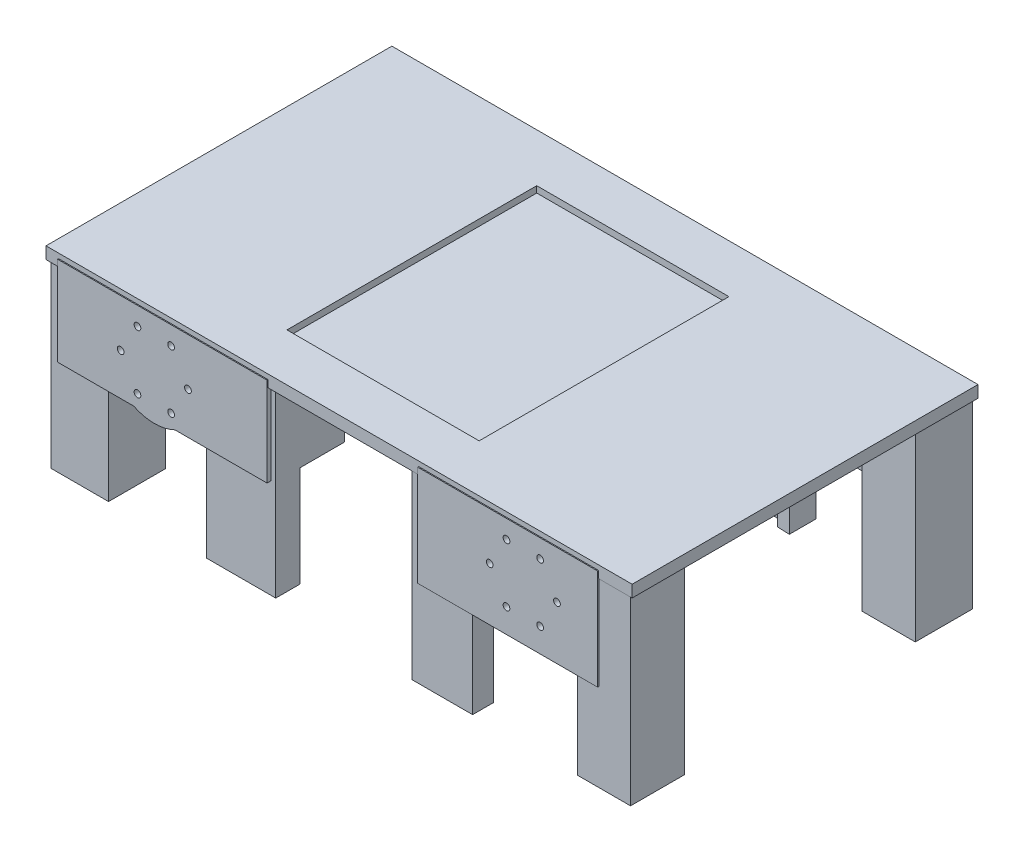
from build123d import *

# Parameters (mm, degrees)
MOTORHOLDERS_DEPTH            = 80
MOTORHOLDERS_DEPTH_BACK       = 80
MOTORHOLDERSSKETCH_R          = 21.41
MOTORHOLDERS_2_DEPTH          = 80
MOTORHOLDERS_2_DEPTH_BACK     = 80
BOSS_EXTRUDE2_DEPTH           = 70
BOSS_EXTRUDE2_DEPTH_BACK      = 70
SKETCH3_W                     = 166.402948119
SKETCH3_H                     = 2.817422897
SKETCH4_W                     = 262.774983374
SKETCH4_H                     = 153.112553215
CUT_EXTRUDE1_DEPTH            = 23
POWERBANKHOLDERS_DEPTH        = 30
POWERBANKHOLDERS_DEPTH_BACK   = 55
SKETCH6_W                     = 26.20968079
SKETCH6_H                     = 26.243040839
SKETCH6_W_2                   = 11.777309193
SKETCH6_H_2                   = 11.261449091
POWERBANKHOLDERS_2_DEPTH      = 30
POWERBANKHOLDERS_2_DEPTH_BACK = 55
SKETCH6_W_3                   = 26.524237007
SKETCH6_H_3                   = 26.17260787
SKETCH6_W_4                   = 10.842850571
SKETCH6_H_4                   = 10.347679347
POWERBANKHOLDERS_3_DEPTH      = 30
POWERBANKHOLDERS_3_DEPTH_BACK = 55
SKETCH6_W_5                   = 25.974547647
SKETCH6_H_5                   = 37.111507406
SKETCH6_W_6                   = 12.844328805
SKETCH6_H_6                   = 18.336479725
POWERBANKHOLDERS_4_DEPTH      = 30
POWERBANKHOLDERS_4_DEPTH_BACK = 55
SKETCH6_W_7                   = 27.98753178
SKETCH6_H_7                   = 35.272094794
SKETCH6_W_8                   = 11.134493861
SKETCH6_H_8                   = 18.035399163
POWERBANKHOLDERS_5_DEPTH      = 30
POWERBANKHOLDERS_5_DEPTH_BACK = 55
SKETCH6_W_9                   = 26.759459577
SKETCH6_H_9                   = 34.283972021
SKETCH6_W_10                  = 12.407504742
SKETCH6_H_10                  = 16.443461188
POWERBANKHOLDERS_6_DEPTH      = 30
POWERBANKHOLDERS_6_DEPTH_BACK = 55
SKETCH6_W_11                  = 31.818060433
SKETCH6_H_11                  = 31.633592667
SKETCH6_W_12                  = 16.537391535
SKETCH6_H_12                  = 14.436538778
POWERBANKHOLDERS_7_DEPTH      = 30
POWERBANKHOLDERS_7_DEPTH_BACK = 55
SKETCH6_W_13                  = 24.409884126
SKETCH6_H_13                  = 24.933985152
SKETCH6_W_14                  = 10.177859407
SKETCH6_H_14                  = 9.83070569
POWERBANKHOLDERS_8_DEPTH      = 30
POWERBANKHOLDERS_8_DEPTH_BACK = 55
SKETCH6_W_15                  = 24.61731082
SKETCH6_H_15                  = 26.330219561
SKETCH6_W_16                  = 9.898416255
SKETCH6_H_16                  = 10.635603546
POWERBANKEXTRUDE_DEPTH        = 64
BOSS_EXTRUDE3_DEPTH           = 2.5
BOSS_EXTRUDE3_DEPTH_BACK      = 3
SKETCH21_W                    = 270.025204679
SKETCH21_H                    = 159.338651477
SKETCH21_W_2                  = 88.537320887
SKETCH21_H_2                  = 115.069025425
SKETCH23_W                    = 96.536837063
SKETCH23_H                    = 41.055975383
SKETCH23_W_2                  = 82.936115801
SKETCH23_H_2                  = 46.337438803
BOSS_EXTRUDE4_DEPTH           = 6
SKETCH24_W                    = 62.643465408
SKETCH24_H                    = 50.528719877
SKETCH24_W_2                  = 58.820967712
SKETCH24_H_2                  = 44.894163551
BOSS_EXTRUDE5_DEPTH           = 6
SKETCH17_R                    = 1.55
BOLTHOLES1_DEPTH              = 31.5
SKETCH19_R                    = 1.55
BOLTHOLES2_DEPTH              = 31.5
BOLTHOLESSKETCH3_R            = 1.55
BOLTHOLES3_DEPTH              = 31.5
BOLTHOLESSKETCH4_R            = 1.55
BOLTHOLES4_DEPTH              = 15
MOTORHOLDEREXTRUDE_DEPTH      = 77
MOTORHOLDEREXTRUDE_DEPTH_BACK = 77
MOTORHOLDEREXTRUDESKETCH_R    = 18.415


with BuildPart() as part:
    # MotorHoldersSketch → MotorHolders (new, two sides: drawn at the far end of the back side and taken through both)
    with BuildSketch(Plane.XY.offset(-MOTORHOLDERS_DEPTH_BACK)):
        Circle(MOTORHOLDERSSKETCH_R)
    extrude(amount=MOTORHOLDERS_DEPTH + MOTORHOLDERS_DEPTH_BACK)


with BuildPart() as body_2:
    # MotorHoldersSketch → MotorHolders 2 (new, two sides: drawn at the far end of the back side and taken through both)
    with BuildSketch(Plane.XY.offset(-MOTORHOLDERS_2_DEPTH_BACK)):
        with Locations((170, 0)):
            Circle(MOTORHOLDERSSKETCH_R)
    extrude(amount=MOTORHOLDERS_2_DEPTH + MOTORHOLDERS_2_DEPTH_BACK)

    # Sketch3 → Boss-Extrude2 (add, two sides: drawn at the far end of the back side and taken through both)
    with BuildSketch(Plane.XY.offset(-BOSS_EXTRUDE2_DEPTH_BACK)):
        with Locations((85.14207121, 19.724241304)):
            Rectangle(SKETCH3_W, SKETCH3_H)
    extrude(amount=BOSS_EXTRUDE2_DEPTH + BOSS_EXTRUDE2_DEPTH_BACK)


with BuildPart() as cut_extrude1_tool:
    # Sketch4 → Cut-Extrude1 (new body)
    with BuildSketch(Plane(origin=(0, 0, 0), x_dir=(1, 0, 0), z_dir=(0, 1, 0))):
        with Locations((89.893628689, 0.176832173)):
            Rectangle(SKETCH4_W, SKETCH4_H)
    extrude(amount=-CUT_EXTRUDE1_DEPTH)


with BuildPart() as part_1:
    add(part.part)

    # Cut-Extrude1: cut by cut_extrude1_tool
    add(cut_extrude1_tool.part, mode=Mode.SUBTRACT)


with BuildPart() as body_2_1:
    add(body_2.part)

    # Cut-Extrude1: cut by cut_extrude1_tool
    add(cut_extrude1_tool.part, mode=Mode.SUBTRACT)


with BuildPart() as body_3:
    # Sketch6 → PowerBankHolders (new, two sides: drawn at the far end of the back side and taken through both)
    with BuildSketch(Plane(origin=(170, -34.829272125, 0), x_dir=(-1, 0, 0), z_dir=(0, -1, 0)).offset(-POWERBANKHOLDERS_DEPTH_BACK)):
        with Locations((206.481006144, 65.827471534)):
            Rectangle(SKETCH6_W, SKETCH6_H)
        with Locations((207.876312411, 66.142860377)):
            Rectangle(SKETCH6_W_2, SKETCH6_H_2, mode=Mode.SUBTRACT)
    extrude(amount=POWERBANKHOLDERS_DEPTH + POWERBANKHOLDERS_DEPTH_BACK)



with BuildPart() as body_4:
    # Sketch6 → PowerBankHolders 2 (new, two sides: drawn at the far end of the back side and taken through both)
    with BuildSketch(Plane(origin=(170, -34.829272125, 0), x_dir=(-1, 0, 0), z_dir=(0, -1, 0)).offset(-POWERBANKHOLDERS_2_DEPTH_BACK)):
        with Locations((206.052608998, -65.195848087)):
            Rectangle(SKETCH6_W_3, SKETCH6_H_3)
        with Locations((206.519672379, -65.314281269)):
            Rectangle(SKETCH6_W_4, SKETCH6_H_4, mode=Mode.SUBTRACT)
    extrude(amount=POWERBANKHOLDERS_2_DEPTH + POWERBANKHOLDERS_2_DEPTH_BACK)


with BuildPart() as body_5:
    # Sketch6 → PowerBankHolders 3 (new, two sides: drawn at the far end of the back side and taken through both)
    with BuildSketch(Plane(origin=(170, -34.829272125, 0), x_dir=(-1, 0, 0), z_dir=(0, -1, 0)).offset(-POWERBANKHOLDERS_3_DEPTH_BACK)):
        with Locations((35.900670436, 59.306920349)):
            Rectangle(SKETCH6_W_5, SKETCH6_H_5)
        with Locations((34.93306737, 60.00949088)):
            Rectangle(SKETCH6_W_6, SKETCH6_H_6, mode=Mode.SUBTRACT)
    extrude(amount=POWERBANKHOLDERS_3_DEPTH + POWERBANKHOLDERS_3_DEPTH_BACK)


with BuildPart() as body_6:
    # Sketch6 → PowerBankHolders 4 (new, two sides: drawn at the far end of the back side and taken through both)
    with BuildSketch(Plane(origin=(170, -34.829272125, 0), x_dir=(-1, 0, 0), z_dir=(0, -1, 0)).offset(-POWERBANKHOLDERS_4_DEPTH_BACK)):
        with Locations((37.912736024, -61.807610384)):
            Rectangle(SKETCH6_W_7, SKETCH6_H_7)
        with Locations((37.73953158, -63.792391966)):
            Rectangle(SKETCH6_W_8, SKETCH6_H_8, mode=Mode.SUBTRACT)
    extrude(amount=POWERBANKHOLDERS_4_DEPTH + POWERBANKHOLDERS_4_DEPTH_BACK)


with BuildPart() as body_7:
    # Sketch6 → PowerBankHolders 5 (new, two sides: drawn at the far end of the back side and taken through both)
    with BuildSketch(Plane(origin=(170, -34.829272125, 0), x_dir=(-1, 0, 0), z_dir=(0, -1, 0)).offset(-POWERBANKHOLDERS_5_DEPTH_BACK)):
        with Locations((134.209542595, 61.807005942)):
            Rectangle(SKETCH6_W_9, SKETCH6_H_9)
        with Locations((134.3262096, 63.551854329)):
            Rectangle(SKETCH6_W_10, SKETCH6_H_10, mode=Mode.SUBTRACT)
    extrude(amount=POWERBANKHOLDERS_5_DEPTH + POWERBANKHOLDERS_5_DEPTH_BACK)


with BuildPart() as body_8:
    # Sketch6 → PowerBankHolders 6 (new, two sides: drawn at the far end of the back side and taken through both)
    with BuildSketch(Plane(origin=(170, -34.829272125, 0), x_dir=(-1, 0, 0), z_dir=(0, -1, 0)).offset(-POWERBANKHOLDERS_6_DEPTH_BACK)):
        with Locations((131.680242167, -62.465355689)):
            Rectangle(SKETCH6_W_11, SKETCH6_H_11)
        with Locations((132.261266204, -63.269851553)):
            Rectangle(SKETCH6_W_12, SKETCH6_H_12, mode=Mode.SUBTRACT)
    extrude(amount=POWERBANKHOLDERS_6_DEPTH + POWERBANKHOLDERS_6_DEPTH_BACK)


with BuildPart() as body_9:
    # Sketch6 → PowerBankHolders 7 (new, two sides: drawn at the far end of the back side and taken through both)
    with BuildSketch(Plane(origin=(170, -34.829272125, 0), x_dir=(-1, 0, 0), z_dir=(0, -1, 0)).offset(-POWERBANKHOLDERS_7_DEPTH_BACK)):
        with Locations((-36.645694428, -66.976665205)):
            Rectangle(SKETCH6_W_13, SKETCH6_H_13)
        with Locations((-36.725173705, -67.894738702)):
            Rectangle(SKETCH6_W_14, SKETCH6_H_14, mode=Mode.SUBTRACT)
    extrude(amount=POWERBANKHOLDERS_7_DEPTH + POWERBANKHOLDERS_7_DEPTH_BACK)


with BuildPart() as body_10:
    # Sketch6 → PowerBankHolders 8 (new, two sides: drawn at the far end of the back side and taken through both)
    with BuildSketch(Plane(origin=(170, -34.829272125, 0), x_dir=(-1, 0, 0), z_dir=(0, -1, 0)).offset(-POWERBANKHOLDERS_8_DEPTH_BACK)):
        with Locations((-36.749407775, 64.697564271)):
            Rectangle(SKETCH6_W_15, SKETCH6_H_15)
        with Locations((-36.585452129, 63.859928969)):
            Rectangle(SKETCH6_W_16, SKETCH6_H_16, mode=Mode.SUBTRACT)
    extrude(amount=POWERBANKHOLDERS_8_DEPTH + POWERBANKHOLDERS_8_DEPTH_BACK)


with BuildPart() as powerbankextrude_tool:
    # Sketch11 → PowerBankExtrude (new body)
    with BuildSketch(Plane(origin=(0, -18.425, 0), x_dir=(1, 0, 0), z_dir=(0, 1, 0))):
        Polygon((-18.932660375, -64.758061011), (-18.932660375, 72.241938989), (188.932660375, 63.758061011), (188.932660375, -71.241938989), align=None)
    extrude(amount=-POWERBANKEXTRUDE_DEPTH)


with BuildPart() as body_5_1:
    add(body_5.part)

    # PowerBankExtrude: cut by powerbankextrude_tool
    add(powerbankextrude_tool.part, mode=Mode.SUBTRACT)


with BuildPart() as body_6_1:
    add(body_6.part)

    # PowerBankExtrude: cut by powerbankextrude_tool
    add(powerbankextrude_tool.part, mode=Mode.SUBTRACT)


with BuildPart() as body_7_1:
    add(body_7.part)

    # PowerBankExtrude: cut by powerbankextrude_tool
    add(powerbankextrude_tool.part, mode=Mode.SUBTRACT)


with BuildPart() as body_8_1:
    add(body_8.part)

    # PowerBankExtrude: cut by powerbankextrude_tool
    add(powerbankextrude_tool.part, mode=Mode.SUBTRACT)


with BuildPart() as body_3_1:
    add(body_3.part)

    add(body_4.part)  # Boss-Extrude3 merges body 4

    add(body_2_1.part)  # Boss-Extrude3 merges body 2

    add(part_1.part)  # Boss-Extrude3 merges part

    add(body_5_1.part)  # Boss-Extrude3 merges body 5

    add(body_6_1.part)  # Boss-Extrude3 merges body 6

    add(body_7_1.part)  # Boss-Extrude3 merges body 7

    add(body_8_1.part)  # Boss-Extrude3 merges body 8
    # Sketch21 → Boss-Extrude3 (add, two sides: drawn at the far end of the back side and taken through both)
    with BuildSketch(Plane(origin=(0, 21.575, 0), x_dir=(1, 0, 0), z_dir=(0, 1, 0)).offset(-BOSS_EXTRUDE3_DEPTH_BACK)):
        with Locations((84.671553553, 0.120575027)):
            Rectangle(SKETCH21_W, SKETCH21_H)
        with Locations((82.978570093, -0.057259585)):
            Rectangle(SKETCH21_W_2, SKETCH21_H_2, mode=Mode.SUBTRACT)
    extrude(amount=BOSS_EXTRUDE3_DEPTH + BOSS_EXTRUDE3_DEPTH_BACK)


    add(body_9.part)  # Boss-Extrude4 merges body 9
    # Sketch23 → Boss-Extrude4 (add)
    with BuildSketch(Plane.XY.offset(80)):
        with Locations((3.678292121, 1.312207193)):
            Rectangle(SKETCH23_W, SKETCH23_H)
        with Locations((162.789906406, -1.328524518)):
            Rectangle(SKETCH23_W_2, SKETCH23_H_2)
    extrude(amount=-BOSS_EXTRUDE4_DEPTH)


    add(body_10.part)  # Boss-Extrude5 merges body 10
    # Sketch24 → Boss-Extrude5 (add)
    with BuildSketch(Plane(origin=(0, 0, -80), x_dir=(-1, 0, 0), z_dir=(0, 0, -1))):
        with Locations((-170.868787608, -6.026953054)):
            Rectangle(SKETCH24_W, SKETCH24_H)
        with Locations((0.140003395, 0.075515568)):
            Rectangle(SKETCH24_W_2, SKETCH24_H_2)
    extrude(amount=-BOSS_EXTRUDE5_DEPTH)

    # Sketch17 → BoltHoles1 (cut)
    with BuildSketch(Plane.XY.offset(80)):
        with Locations((185.5, 0)):
            Circle(SKETCH17_R)
        with Locations((177.75, -13.42)):
            Circle(SKETCH17_R)
        with Locations((162.25, -13.42)):
            Circle(SKETCH17_R)
        with Locations((154.5, 0)):
            Circle(SKETCH17_R)
        with Locations((162.25, 13.42)):
            Circle(SKETCH17_R)
        with Locations((177.75, 13.42)):
            Circle(SKETCH17_R)
    extrude(amount=-BOLTHOLES1_DEPTH, mode=Mode.SUBTRACT)

    # Sketch19 → BoltHoles2 (cut)
    with BuildSketch(Plane(origin=(0, 0, -80), x_dir=(-1, 0, 0), z_dir=(0, 0, -1))):
        with Locations((-185.5, 0)):
            Circle(SKETCH19_R)
        with Locations((-177.75, -13.42)):
            Circle(SKETCH19_R)
        with Locations((-162.25, -13.42)):
            Circle(SKETCH19_R)
        with Locations((-154.5, 0)):
            Circle(SKETCH19_R)
        with Locations((-162.25, 13.42)):
            Circle(SKETCH19_R)
        with Locations((-177.75, 13.42)):
            Circle(SKETCH19_R)
    extrude(amount=-BOLTHOLES2_DEPTH, mode=Mode.SUBTRACT)

    # BoltHolesSketch3 → BoltHoles3 (cut)
    with BuildSketch(Plane.XY.offset(80)):
        with Locations((7.75, -13.42)):
            Circle(BOLTHOLESSKETCH3_R)
        with Locations((15.5, 0)):
            Circle(BOLTHOLESSKETCH3_R)
        with Locations((7.75, 13.42)):
            Circle(BOLTHOLESSKETCH3_R)
        with Locations((-7.75, 13.42)):
            Circle(BOLTHOLESSKETCH3_R)
        with Locations((-15.5, 0)):
            Circle(BOLTHOLESSKETCH3_R)
        with Locations((-7.75, -13.42)):
            Circle(BOLTHOLESSKETCH3_R)
    extrude(amount=-BOLTHOLES3_DEPTH, mode=Mode.SUBTRACT)

    # BoltHolesSketch4 → BoltHoles4 (cut)
    with BuildSketch(Plane(origin=(0, 0, -80), x_dir=(-1, 0, 0), z_dir=(0, 0, -1))):
        with Locations((-15.5, 0)):
            Circle(BOLTHOLESSKETCH4_R)
        with Locations((-7.75, 13.42)):
            Circle(BOLTHOLESSKETCH4_R)
        with Locations((7.75, 13.42)):
            Circle(BOLTHOLESSKETCH4_R)
        with Locations((15.5, 0)):
            Circle(BOLTHOLESSKETCH4_R)
        with Locations((7.75, -13.42)):
            Circle(BOLTHOLESSKETCH4_R)
        with Locations((-7.75, -13.42)):
            Circle(BOLTHOLESSKETCH4_R)
    extrude(amount=-BOLTHOLES4_DEPTH, mode=Mode.SUBTRACT)

    # MotorHolderExtrudeSketch → MotorHolderExtrude (cut, two sides: drawn at the far end of the back side and taken through both)
    with BuildSketch(Plane.XY.offset(-MOTORHOLDEREXTRUDE_DEPTH_BACK)):
        with Locations((170, 0)):
            Circle(MOTORHOLDEREXTRUDESKETCH_R)
        Circle(MOTORHOLDEREXTRUDESKETCH_R)
    extrude(amount=MOTORHOLDEREXTRUDE_DEPTH + MOTORHOLDEREXTRUDE_DEPTH_BACK, mode=Mode.SUBTRACT)


solid = body_3_1.part
